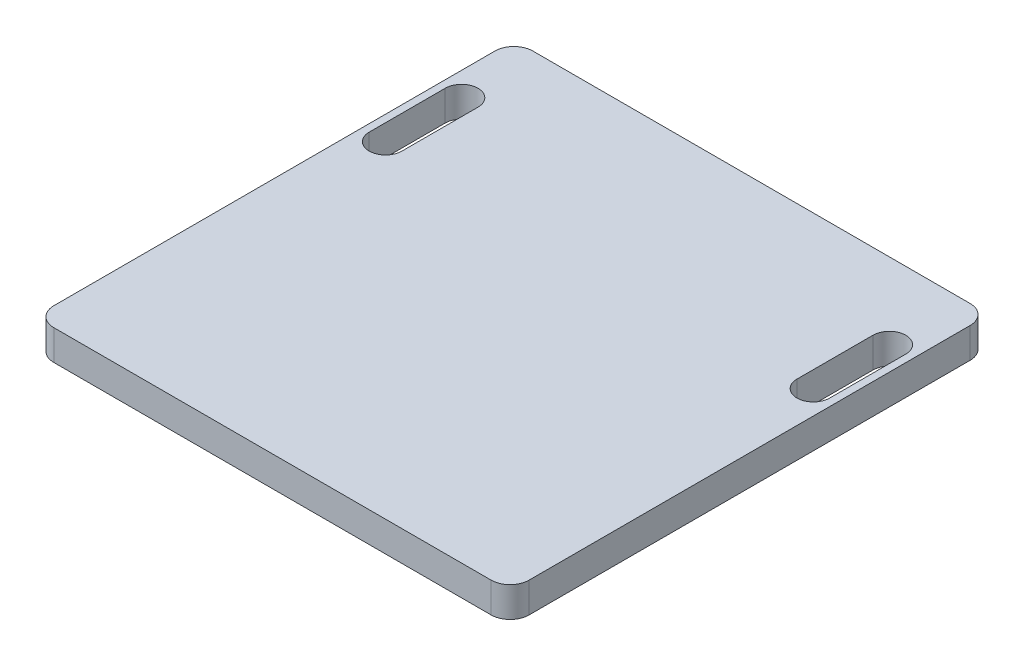
from build123d import *

# Parameters (mm, degrees)
SKETCH1_W           = 50
SKETCH1_H           = 50.4
BOSS_EXTRUDE1_DEPTH = 3.175
FILLET1_R           = 2


with BuildPart() as part:
    # Sketch1 → Boss-Extrude1 (new body)
    with BuildSketch(Plane(origin=(0, 0, 0), x_dir=(1, 0, 0), z_dir=(0, 1, 0))):
        with Locations((22.5, -17.2)):
            Rectangle(SKETCH1_W, SKETCH1_H)
        with BuildLine():
            ThreePointArc((-1.725, 0), (0, 1.725), (1.725, 0))
            Line((1.725, 0), (1.725, -8))
            ThreePointArc((1.725, -8), (0, -9.725), (-1.725, -8))
            Line((-1.725, -8), (-1.725, 0))
        make_face(mode=Mode.SUBTRACT)
        with BuildLine():
            ThreePointArc((43.275, 0), (45, 1.725), (46.725, 0))
            Line((46.725, 0), (46.725, -8))
            ThreePointArc((46.725, -8), (45, -9.725), (43.275, -8))
            Line((43.275, -8), (43.275, 0))
        make_face(mode=Mode.SUBTRACT)
    extrude(amount=BOSS_EXTRUDE1_DEPTH)

    # Fillet1
    fillet1_edges = [part.edges().sort_by_distance(p)[0] for p in [
        (47.5, 1.5875, -8),
        (-2.5, 1.5875, -8),
        (47.5, 1.5875, 42.4),
        (-2.5, 1.5875, 42.4),
    ]]
    fillet(fillet1_edges, radius=FILLET1_R)


solid = part.part
